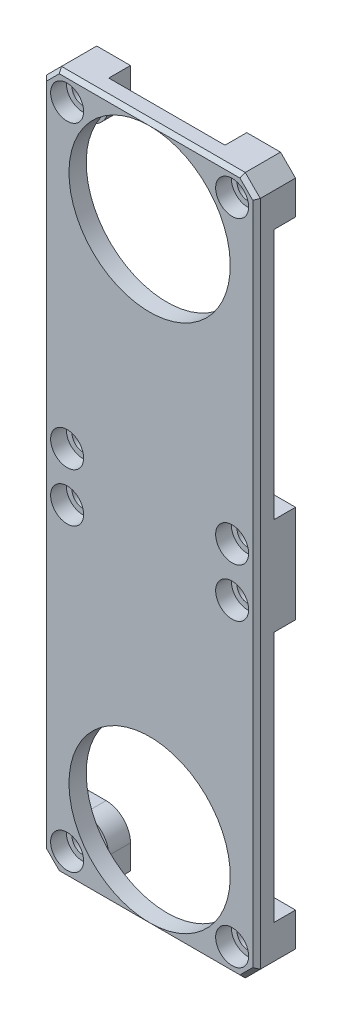
from build123d import *

# Parameters (mm, degrees)
SKETCH2_W                                  = 28.5
SKETCH2_H                                  = 93
SKETCH2_R                                  = 10.75
BOSS_EXTRUDE1_DEPTH                        = 2.3
BOSS_EXTRUDE2_DEPTH                        = 2.9
CBORE_FOR_M2_5_PAN_HEAD_SCREW1_D           = 2.9
CBORE_FOR_M2_5_PAN_HEAD_SCREW1_DEPTH       = 8
CBORE_FOR_M2_5_PAN_HEAD_SCREW1_CBORE_D     = 4.4
CBORE_FOR_M2_5_PAN_HEAD_SCREW1_CBORE_DEPTH = 2.1
CBORE_FOR_M2_5_PAN_HEAD_SCREW1_TIP         = 0.871247898
CHAMFER1_SIZE                              = 2
CHAMFER2_SIZE                              = 0.5


with BuildPart() as part:
    # Sketch2 → Boss-Extrude1 (new body)
    with BuildSketch(Plane.XY):
        with Locations((0, -35.25)):
            Rectangle(SKETCH2_W, SKETCH2_H)
        Circle(SKETCH2_R, mode=Mode.SUBTRACT)
        with Locations(Location((0, -70.5, 0), (0, 0, 180))):
            Circle(SKETCH2_R, mode=Mode.SUBTRACT)
    extrude(amount=BOSS_EXTRUDE1_DEPTH)

    # Sketch3 → Boss-Extrude2 (add)
    with BuildSketch(Plane(origin=(0, 0, 0), x_dir=(-1, 0, 0), z_dir=(0, 0, -1))):
        with BuildLine():
            Line((7.75, 11.25), (7.75, 8))
            ThreePointArc((7.75, 8), (8.701902961, 5.701902961), (11, 4.75))
            Line((11, 4.75), (14.25, 4.75))
            Line((14.25, 4.75), (14.25, 11.25))
            Line((14.25, 11.25), (7.75, 11.25))
        make_face()
        with BuildLine():
            Line((11, -41.75), (14.25, -41.75))
            Line((14.25, -41.75), (14.25, -28.75))
            Line((14.25, -28.75), (11, -28.75))
            ThreePointArc((11, -28.75), (8.701902961, -29.701902961), (7.75, -32))
            Line((7.75, -32), (7.75, -38.5))
            ThreePointArc((7.75, -38.5), (8.701902961, -40.798097039), (11, -41.75))
        make_face()
        with BuildLine():
            Line((14.25, -81.75), (7.75, -81.75))
            Line((7.75, -81.75), (7.75, -78.5))
            ThreePointArc((7.75, -78.5), (8.701902961, -76.201902961), (11, -75.25))
            Line((11, -75.25), (14.25, -75.25))
            Line((14.25, -75.25), (14.25, -81.75))
        make_face()
        with BuildLine():
            Line((-14.25, 11.25), (-7.75, 11.25))
            Line((-7.75, 11.25), (-7.75, 8))
            ThreePointArc((-7.75, 8), (-8.701902961, 5.701902961), (-11, 4.75))
            Line((-11, 4.75), (-14.25, 4.75))
            Line((-14.25, 4.75), (-14.25, 11.25))
        make_face()
        with BuildLine():
            Line((-7.75, -38.5), (-7.75, -32))
            ThreePointArc((-7.75, -32), (-8.701902961, -29.701902961), (-11, -28.75))
            Line((-11, -28.75), (-14.25, -28.75))
            Line((-14.25, -28.75), (-14.25, -41.75))
            Line((-14.25, -41.75), (-11, -41.75))
            ThreePointArc((-11, -41.75), (-8.701902961, -40.798097039), (-7.75, -38.5))
        make_face()
        with BuildLine():
            Line((-7.75, -81.75), (-7.75, -78.5))
            ThreePointArc((-7.75, -78.5), (-8.701902961, -76.201902961), (-11, -75.25))
            Line((-11, -75.25), (-14.25, -75.25))
            Line((-14.25, -75.25), (-14.25, -81.75))
            Line((-14.25, -81.75), (-7.75, -81.75))
        make_face()
    extrude(amount=BOSS_EXTRUDE2_DEPTH)

    # CBORE for M2.5 Pan Head Screw1
    with Locations(Plane.XY.offset(2.3)):
        with Locations((-11, 8), (11, 8), (11, -32), (-11, -32), (-11, -38.5), (11, -38.5), (11, -78.5), (-11, -78.5)):
            CounterBoreHole(CBORE_FOR_M2_5_PAN_HEAD_SCREW1_D / 2, CBORE_FOR_M2_5_PAN_HEAD_SCREW1_CBORE_D / 2, CBORE_FOR_M2_5_PAN_HEAD_SCREW1_CBORE_DEPTH, depth=CBORE_FOR_M2_5_PAN_HEAD_SCREW1_DEPTH)
            with Locations((0, 0, -(CBORE_FOR_M2_5_PAN_HEAD_SCREW1_DEPTH + CBORE_FOR_M2_5_PAN_HEAD_SCREW1_TIP / 2))):  # 118° drill point
                Cone(0, CBORE_FOR_M2_5_PAN_HEAD_SCREW1_D / 2, CBORE_FOR_M2_5_PAN_HEAD_SCREW1_TIP, mode=Mode.SUBTRACT)

    # Chamfer1
    chamfer1_edges = [part.edges().sort_by_distance(p)[0] for p in [
        (-14.25, 11.25, -0.3),
        (14.25, 11.25, -0.3),
        (14.25, -81.75, -0.3),
        (-14.25, -81.75, -0.3),
    ]]
    chamfer(chamfer1_edges, length=CHAMFER1_SIZE)

    # Chamfer2
    chamfer2_edges = [part.edges().sort_by_distance(p)[0] for p in [
        (0, -81.75, 2.3),
        (-14.25, -35.25, 2.3),
        (14.25, -35.25, 2.3),
        (0, 11.25, 2.3),
        (-13.25, 10.25, 2.3),
        (13.25, 10.25, 2.3),
        (13.25, -80.75, 2.3),
        (-13.25, -80.75, 2.3),
    ]]
    chamfer(chamfer2_edges, length=CHAMFER2_SIZE - 0.0001)  # a hair under: the kernel refuses the full size


solid = part.part
